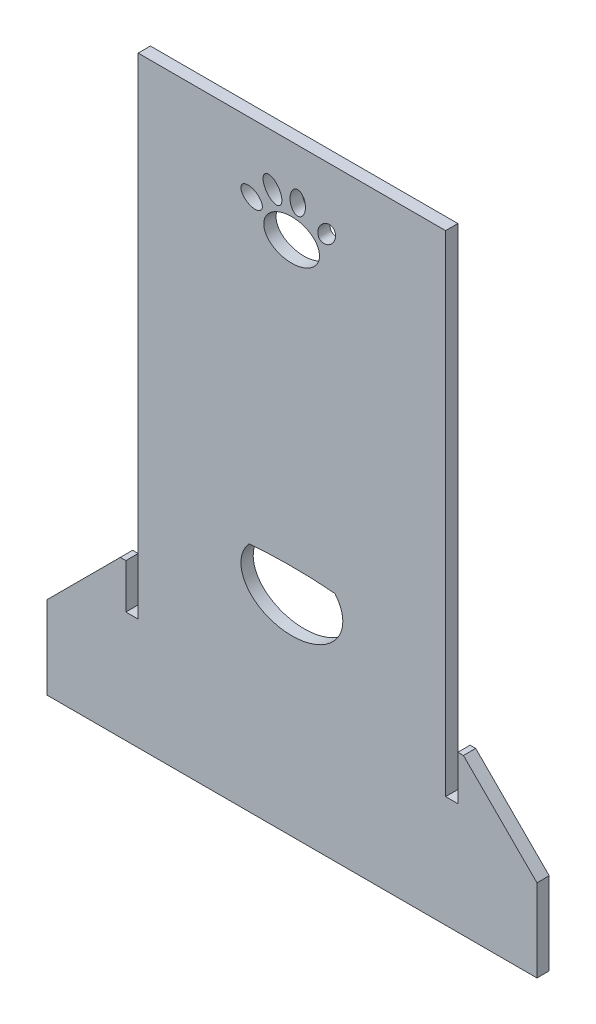
from build123d import *

# Parameters (mm, degrees)
EXTRUDE_1_DEPTH          = 5.5
CUT_EXTRUDE_1_DEPTH      = 325.100293119
SKETCH_3_W               = 5.5
SKETCH_3_H               = 20
CUT_EXTRUDE_2_DEPTH      = 324.99266981
CUT_EXTRUDE_3_DEPTH      = 324.99266981
CUT_EXTRUDE_3_DEPTH_BACK = 324.99266981


with BuildPart() as part:
    # 草圖1 → 填料-伸長1 (new body)
    with BuildSketch(Plane.XY):
        Polygon((138, 270), (0, 270), (0, 70), (-8, 70), (-41, 37), (-41, 0), (179, 0), (179, 37), (146, 70), (138, 70), align=None)
    extrude(amount=EXTRUDE_1_DEPTH)

    # 草圖2 → 除料-伸長1 (cut, through all)
    with BuildSketch(Plane.XY.offset(10)):
        with BuildLine():
            add(Edge.make_bspline(
                [(81.404093546, 231.840492192), (81.404093546, 247.516330372), (62.637720541, 239.678411282), (43.871347535, 231.840492192), (62.637720541, 224.002573103), (81.404093546, 216.164654013), (81.404093546, 231.840492192)],
                knots=[0, 0, 0, 2.094395102, 2.094395102, 4.188790205, 4.188790205, 6.283185307, 6.283185307, 6.283185307], degree=2, weights=[1, 0.5, 1, 0.5, 1, 0.5, 1]))
        make_face()
        with BuildLine():
            add(Edge.make_bspline(
                [(55.428520984, 236.895255819), (58.387355571, 242.091380805), (50.152509748, 243.340068657), (41.917663925, 244.588756509), (47.193675161, 238.143943671), (52.469686398, 231.699130834), (55.428520984, 236.895255819)],
                knots=[0, 0, 0, 2.094395102, 2.094395102, 4.188790205, 4.188790205, 6.283185307, 6.283185307, 6.283185307], degree=2, weights=[1, 0.5, 1, 0.5, 1, 0.5, 1]))
        make_face()
        with BuildLine():
            add(Edge.make_bspline(
                [(57.240522432, 251.86060189), (52.21544806, 248.619761794), (59.31472209, 243.128231518), (66.413996119, 237.636701242), (64.339796462, 246.369071613), (62.265596805, 255.101441985), (57.240522432, 251.86060189)],
                knots=[0, 0, 0, 2.094395102, 2.094395102, 4.188790205, 4.188790205, 6.283185307, 6.283185307, 6.283185307], degree=2, weights=[1, 0.5, 1, 0.5, 1, 0.5, 1]))
        make_face()
        with BuildLine():
            add(Edge.make_bspline(
                [(71.629453281, 242.459740208), (77.608953007, 242.459740208), (74.619203144, 250.172298344), (71.629453281, 257.88485648), (68.639703418, 250.172298344), (65.649953555, 242.459740208), (71.629453281, 242.459740208)],
                knots=[0, 0, 0, 2.094395102, 2.094395102, 4.188790205, 4.188790205, 6.283185307, 6.283185307, 6.283185307], degree=2, weights=[1, 0.5, 1, 0.5, 1, 0.5, 1]))
        make_face()
        with BuildLine():
            add(Edge.make_bspline(
                [(81.677336638, 238.23293454), (86.369644623, 234.526634128), (88.438786653, 241.969705949), (90.507928683, 249.412777769), (83.746478668, 245.676006361), (76.985028653, 241.939234953), (81.677336638, 238.23293454)],
                knots=[0, 0, 0, 2.094395102, 2.094395102, 4.188790205, 4.188790205, 6.283185307, 6.283185307, 6.283185307], degree=2, weights=[1, 0.5, 1, 0.5, 1, 0.5, 1]))
        make_face()
    extrude(amount=-CUT_EXTRUDE_1_DEPTH, mode=Mode.SUBTRACT)

    # 草圖3 → 除料-伸長2 (cut, through all)
    with BuildSketch(Plane.XY.offset(5.5)):
        with Locations((-2.75, 60)):
            Rectangle(SKETCH_3_W, SKETCH_3_H)
        with Locations((140.75, 60)):
            Rectangle(SKETCH_3_W, SKETCH_3_H)
    extrude(amount=-CUT_EXTRUDE_2_DEPTH, mode=Mode.SUBTRACT)

    # 草圖4 → 除料-伸長3 (cut, two sides: drawn at the far end of the back side and taken through both)
    with BuildSketch(Plane.XY.offset(5.5).offset(-CUT_EXTRUDE_3_DEPTH_BACK)):
        with BuildLine():
            add(Edge.make_bspline(
                [(49.702478749, 104.111308821), (27.419050228, 77.998268237), (69, 77.998268237), (110.580949772, 77.998268237), (88.297521251, 104.111308821)],
                knots=[2.576013645, 2.576013645, 2.576013645, 4.71238898, 4.71238898, 6.848764316, 6.848764316, 6.848764316], degree=2, weights=[1, 0.481713218, 1, 0.481713218, 1]))
            add(Edge.make_bspline(
                [(88.297521251, 104.111308821), (69, 105.892103505), (49.702478749, 104.111308821)],
                knots=[1.154534815, 1.154534815, 1.154534815, 1.987057839, 1.987057839, 1.987057839], degree=2, weights=[1, 0.914606964, 1]))
        make_face()
    extrude(amount=CUT_EXTRUDE_3_DEPTH + CUT_EXTRUDE_3_DEPTH_BACK, mode=Mode.SUBTRACT)


solid = part.part
